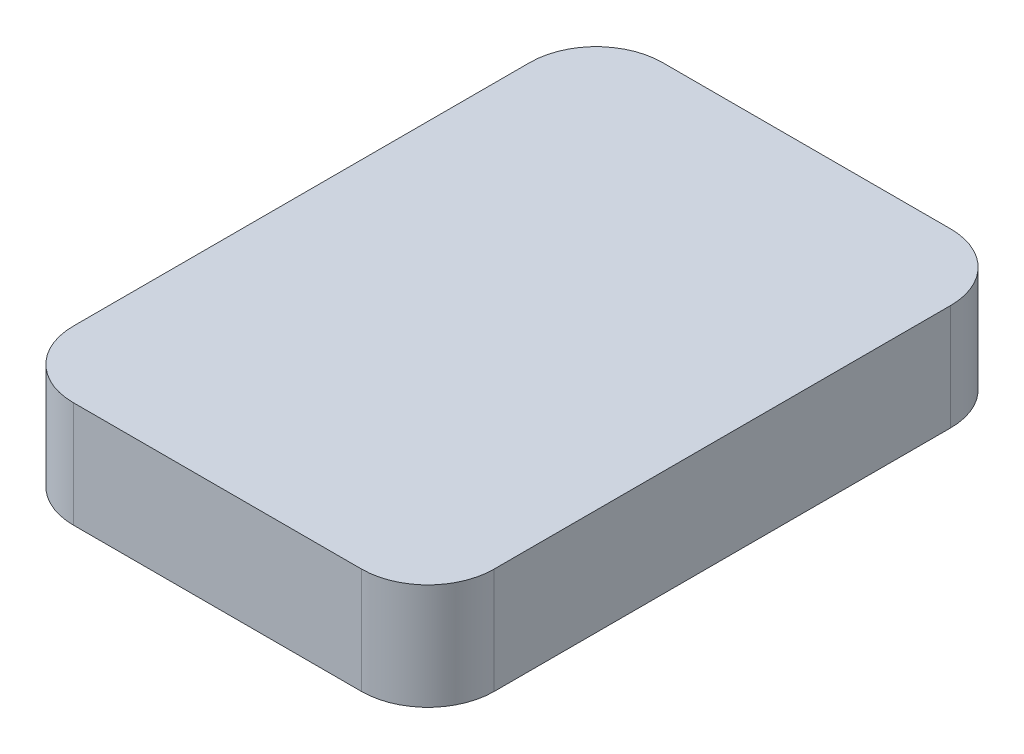
from build123d import *

# Parameters (mm, degrees)
SKETCH1_W           = 63.5
SKETCH1_H           = 88.9
BOSS_EXTRUDE1_DEPTH = 16
FILLET1_R           = 10


with BuildPart() as part:
    # Sketch1 → Boss-Extrude1 (new body)
    with BuildSketch(Plane(origin=(0, 0, 0), x_dir=(1, 0, 0), z_dir=(0, 1, 0))):
        Rectangle(SKETCH1_W, SKETCH1_H)
    extrude(amount=BOSS_EXTRUDE1_DEPTH)

    # Fillet1
    fillet1_edges = [part.edges().sort_by_distance(p)[0] for p in [
        (31.75, 8, 44.45),
        (31.75, 8, -44.45),
        (-31.75, 8, -44.45),
        (-31.75, 8, 44.45),
    ]]
    fillet(fillet1_edges, radius=FILLET1_R)


solid = part.part
